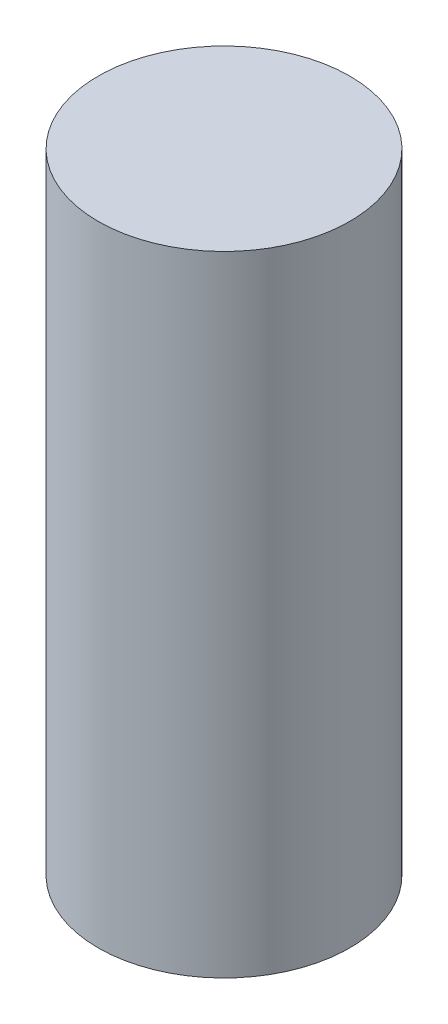
from build123d import *

# Parameters (mm, degrees)
ESQUISSE1_R        = 2
BOSS_EXTRU_1_DEPTH = 10


with BuildPart() as part:
    # Esquisse1 → Boss.-Extru.1 (new body)
    with BuildSketch(Plane(origin=(0, 0, 0), x_dir=(1, 0, 0), z_dir=(0, 1, 0))):
        Circle(ESQUISSE1_R)
    extrude(amount=BOSS_EXTRU_1_DEPTH)


solid = part.part
